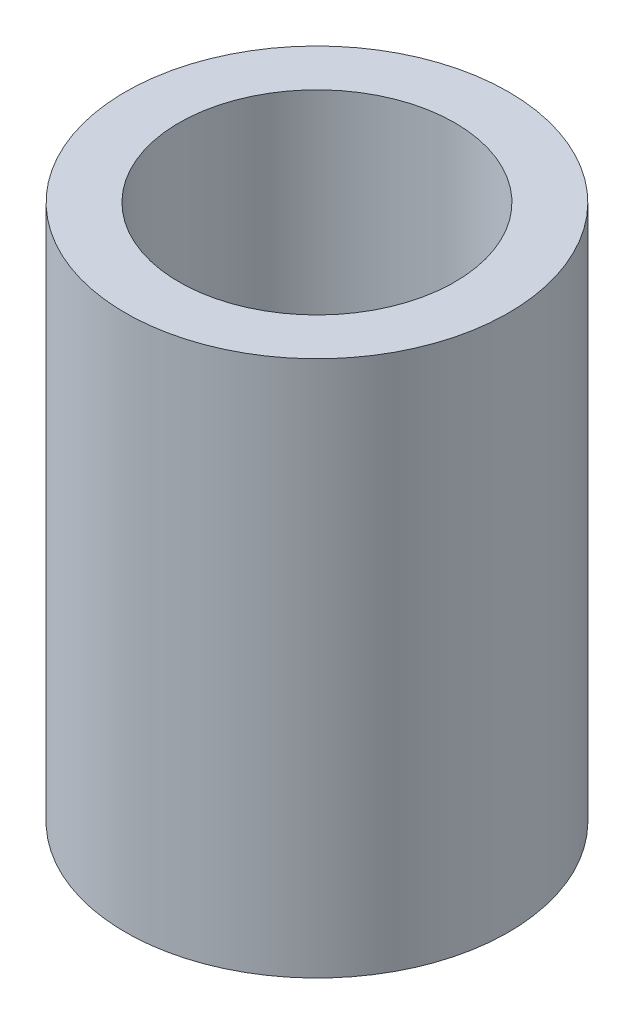
from build123d import *


with BuildPart() as part:
    # Sketch1 → Revolve1 (revolve)
    with BuildSketch(Plane.XY):
        Polygon((12.5, 0), (12.5, 35), (9, 35), (9, 11), (11, 11), (11, 0), align=None)
    revolve(axis=Axis((0, 0, 0), (0, 1, 0)))


solid = part.part
